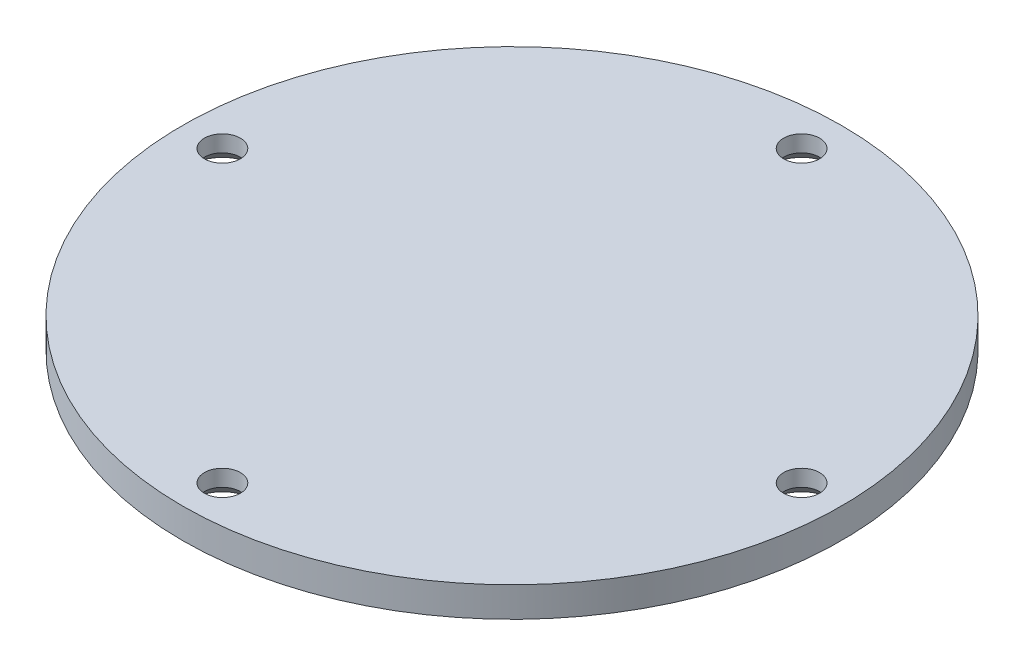
from build123d import *

# Parameters (mm, degrees)
SKETCH1_R                                      = 33
SKETCH1_R_2                                    = 1.5
BOSS_EXTRUDE1_DEPTH                            = 3
CSK_FOR_M3_FLAT_HEAD_MACHINE_SCREW1_AT_2_COUNT = 2
CSK_FOR_M3_FLAT_HEAD_MACHINE_SCREW1_AT_2_PITCH = 41.012193309
CSK_FOR_M3_FLAT_HEAD_MACHINE_SCREW1_AT_3_COUNT = 2
CSK_FOR_M3_FLAT_HEAD_MACHINE_SCREW1_AT_3_PITCH = 58
CSK_FOR_M3_FLAT_HEAD_MACHINE_SCREW1_AT_4_COUNT = 2
CSK_FOR_M3_FLAT_HEAD_MACHINE_SCREW1_AT_4_PITCH = 41.012193309


with BuildPart() as part:
    # Sketch1 → Boss-Extrude1 (new body)
    with BuildSketch(Plane(origin=(0, 0, 0), x_dir=(1, 0, 0), z_dir=(0, 1, 0))):
        Circle(SKETCH1_R)
        with Locations((-29, 0)):
            Circle(SKETCH1_R_2, mode=Mode.SUBTRACT)
        with Locations((0, 29)):
            Circle(SKETCH1_R_2, mode=Mode.SUBTRACT)
        with Locations((29, 0)):
            Circle(SKETCH1_R_2, mode=Mode.SUBTRACT)
        with Locations((0, -29)):
            Circle(SKETCH1_R_2, mode=Mode.SUBTRACT)
    extrude(amount=BOSS_EXTRUDE1_DEPTH)

    # Sketch3 → CSK for M3 Flat Head Machine Screw1 (revolve, cut)
    with BuildSketch(Plane(origin=(0, 0, 29), x_dir=(0, 0, -1), z_dir=(1, 0, 0))):
        Polygon((0, 0), (0, 3), (1.8, 3), (1.8, 1.35), (3.15, 0), align=None)
    csk_for_m3_flat_head_machine_screw1 = revolve(axis=Axis((0, -6.35, 29), (0, 1, 0)), mode=Mode.SUBTRACT)

    # CSK for M3 Flat Head Machine Screw1 at 2: CSK for M3 Flat Head Machine Screw1 ×2
    with Locations(*[Vector(-0.7071067811865476, 0, -0.7071067811865475) * (i * CSK_FOR_M3_FLAT_HEAD_MACHINE_SCREW1_AT_2_PITCH) for i in range(1, CSK_FOR_M3_FLAT_HEAD_MACHINE_SCREW1_AT_2_COUNT)]):
        add(csk_for_m3_flat_head_machine_screw1, mode=Mode.SUBTRACT)

    # CSK for M3 Flat Head Machine Screw1 at 3: CSK for M3 Flat Head Machine Screw1 ×2
    with Locations(*[(0, 0, -i * CSK_FOR_M3_FLAT_HEAD_MACHINE_SCREW1_AT_3_PITCH) for i in range(1, CSK_FOR_M3_FLAT_HEAD_MACHINE_SCREW1_AT_3_COUNT)]):
        add(csk_for_m3_flat_head_machine_screw1, mode=Mode.SUBTRACT)

    # CSK for M3 Flat Head Machine Screw1 at 4: CSK for M3 Flat Head Machine Screw1 ×2
    with Locations(*[Vector(0.7071067811865475, 0, -0.7071067811865476) * (i * CSK_FOR_M3_FLAT_HEAD_MACHINE_SCREW1_AT_4_PITCH) for i in range(1, CSK_FOR_M3_FLAT_HEAD_MACHINE_SCREW1_AT_4_COUNT)]):
        add(csk_for_m3_flat_head_machine_screw1, mode=Mode.SUBTRACT)


solid = part.part
